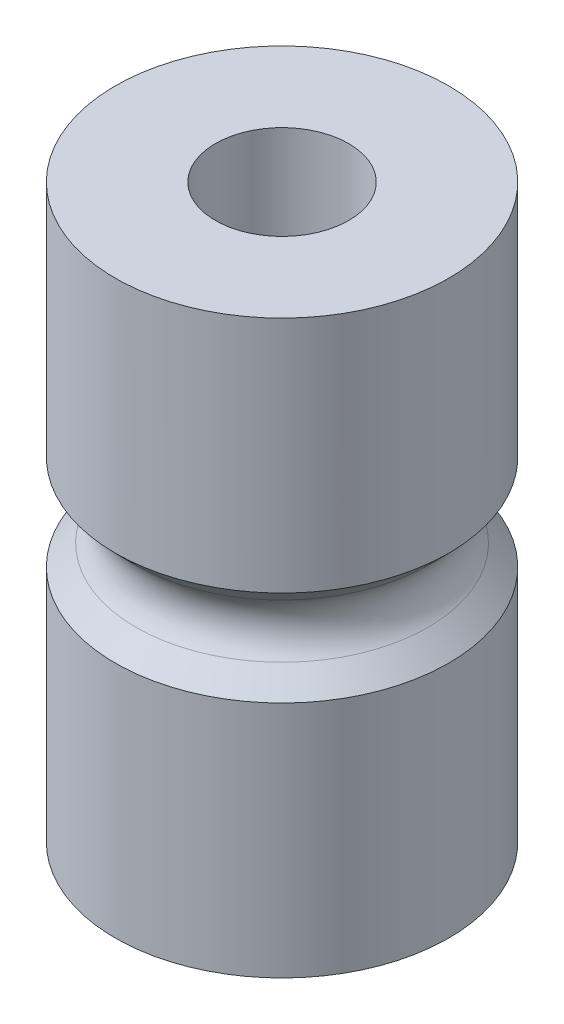
from build123d import *

# Parameters (mm, degrees)
FILLET1_R = 2.54


with BuildPart() as part:
    # Sketch2 → Revolve1 (revolve)
    with BuildSketch(Plane.XY):
        Polygon((4.445, 0), (11.1125, 0), (11.1125, 15.875), (7.9375, 19.05), (11.1125, 22.225), (11.1125, 38.1), (4.445, 38.1), align=None)
    revolve(axis=Axis((0, 0, 0), (0, 1, 0)))

    # Fillet1
    fillet1_edges = [part.edges().sort_by_distance(p)[0] for p in [
        (-7.9375, 19.05, 0),
    ]]
    fillet(fillet1_edges, radius=FILLET1_R)


solid = part.part
